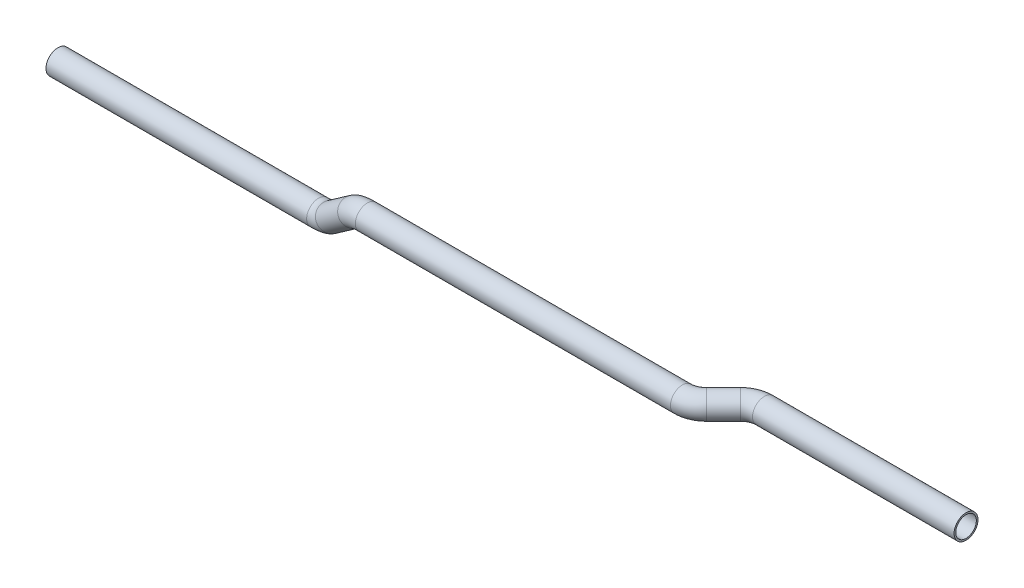
from build123d import *

# Parameters (mm, degrees)
SKETCH1_R   = 6.35
SKETCH1_R_2 = 5.461


with BuildPart() as part:
    # Sweep2: sweep along a curve in space
    with BuildLine() as sweep2_path:
        Line((0, 0, 0), (138.378145362, 0, 0))
        ThreePointArc((138.378145362, 0, 0), (143.238224953, 0.826843386, 0.500895984), (147.358401483, 3.181494132, 1.927327064))
        Line((147.358401483, 3.181494132, 1.927327064), (171.783236386, 24.072036991, 14.582672936))
        ThreePointArc((171.783236386, 24.072036991, 14.582672936), (175.903412916, 26.426687737, 16.009104016), (180.763492508, 27.253531123, 16.51))
        Line((180.763492508, 27.253531123, 16.51), (348.042468023, 27.253531123, 16.51))
        ThreePointArc((348.042468023, 27.253531123, 16.51), (352.902547614, 27.253531123, 15.543270063), (357.022724144, 27.253531123, 12.790256121))
        Line((357.022724144, 27.253531123, 12.790256121), (366.093236386, 27.253531123, 3.719743879))
        ThreePointArc((366.093236386, 27.253531123, 3.719743879), (370.213412916, 27.253531123, 0.966729937), (375.073492508, 27.253531123, 0))
        Line((375.073492508, 27.253531123, 0), (482.098614469, 27.253531123, 0))
    # Sketch1 → Sweep2 (sweep)
    with BuildSketch(Plane(origin=(0, 0, 0), x_dir=(0, 0, -1), z_dir=(1, 0, 0))):
        Circle(SKETCH1_R)
        Circle(SKETCH1_R_2, mode=Mode.SUBTRACT)
    sweep(path=sweep2_path.line)


solid = part.part
